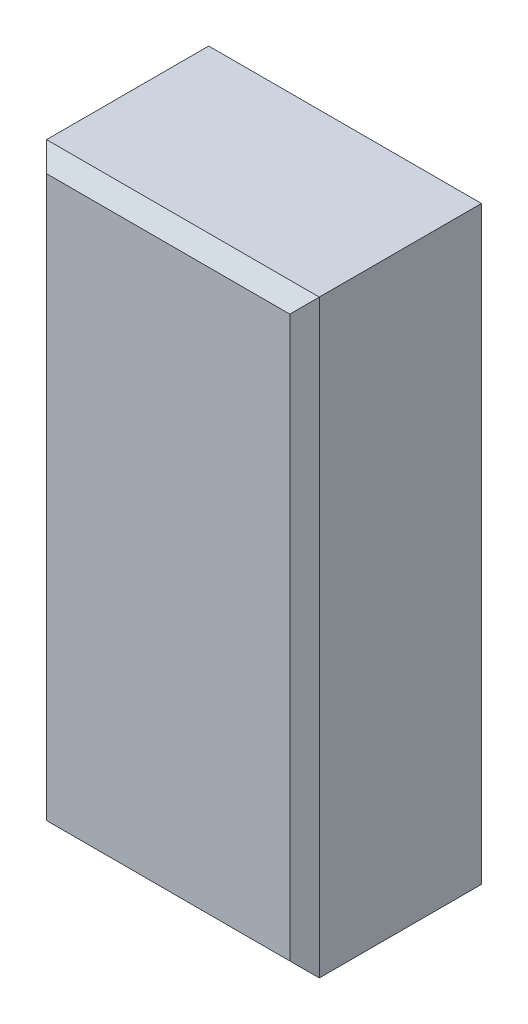
from build123d import *

# Parameters (mm, degrees)
SKETCH1_W           = 18.5
SKETCH1_H           = 40
BOSS_EXTRUDE1_DEPTH = 13
CHAMFER1_SIZE       = 1


with BuildPart() as part:
    # Sketch1 → Boss-Extrude1 (new body)
    with BuildSketch(Plane.XY):
        Rectangle(SKETCH1_W, SKETCH1_H)
    extrude(amount=BOSS_EXTRUDE1_DEPTH)

    # Chamfer1
    chamfer1_edges = [part.edges().sort_by_distance(p)[0] for p in [
        (0, 20, 0),
        (-9.25, 0, 0),
        (0, -20, 0),
        (9.25, 0, 0),
        (0, -20, 13),
        (-9.25, 0, 13),
        (0, 20, 13),
        (9.25, 0, 13),
    ]]
    chamfer(chamfer1_edges, length=CHAMFER1_SIZE)


solid = part.part
